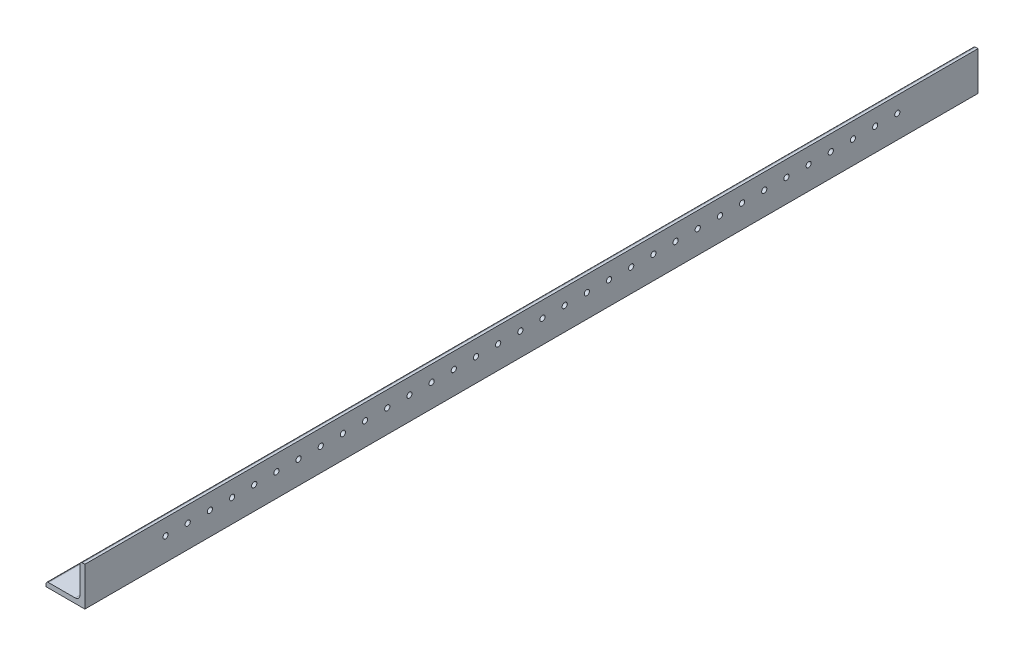
from build123d import *

# Parameters (mm, degrees)
BOSS_EXTRUDE1_DEPTH = 609.6
SKETCH3_W           = 635.2
SKETCH3_H           = 25.4
CUT_EXTRUDE2_DEPTH  = 30.48
SKETCH5_R           = 1.7
CUT_EXTRUDE3_DEPTH  = 611.137198198
SKETCH7_R           = 1.7
CUT_EXTRUDE4_DEPTH  = 611.137198198


with BuildPart() as part:
    # Sketch2 → Boss-Extrude1 (new, symmetric)
    with BuildSketch(Plane.XY):
        with BuildLine():
            Line((-12.7, -12.7), (12.7, -12.7))
            Line((12.7, -12.7), (12.7, 12.7))
            Line((12.7, 12.7), (11.1125, 12.7))
            ThreePointArc((11.1125, 12.7), (9.989967985, 12.235032015), (9.525, 11.1125))
            Line((9.525, 11.1125), (9.525, -6.35))
            ThreePointArc((9.525, -6.35), (8.59506403, -8.59506403), (6.35, -9.525))
            Line((6.35, -9.525), (-11.1125, -9.525))
            ThreePointArc((-11.1125, -9.525), (-12.235032015, -9.989967985), (-12.7, -11.1125))
            Line((-12.7, -11.1125), (-12.7, -12.7))
        make_face()
    extrude(amount=BOSS_EXTRUDE1_DEPTH, both=True)

    # Sketch3 → Cut-Extrude2 (cut)
    with BuildSketch(Plane(origin=(12.7, 0, 0), x_dir=(0, 0, -1), z_dir=(1, 0, 0))):
        with Locations((292, 0)):
            Rectangle(SKETCH3_W, SKETCH3_H)
    extrude(amount=-CUT_EXTRUDE2_DEPTH, mode=Mode.SUBTRACT)

    # Sketch5 → Cut-Extrude3 (cut, through all)
    with BuildSketch(Plane.ZY.offset(-9.525)):
        with Locations((78.35, 2.38125)):
            Circle(SKETCH5_R)
        with Locations((92.85, 2.38125)):
            Circle(SKETCH5_R)
        with Locations((107.35, 2.38125)):
            Circle(SKETCH5_R)
        with Locations((121.85, 2.38125)):
            Circle(SKETCH5_R)
        with Locations((136.35, 2.38125)):
            Circle(SKETCH5_R)
        with Locations((150.85, 2.38125)):
            Circle(SKETCH5_R)
        with Locations((165.35, 2.38125)):
            Circle(SKETCH5_R)
        with Locations((179.85, 2.38125)):
            Circle(SKETCH5_R)
        with Locations((194.35, 2.38125)):
            Circle(SKETCH5_R)
        with Locations((208.85, 2.38125)):
            Circle(SKETCH5_R)
        with Locations((223.35, 2.38125)):
            Circle(SKETCH5_R)
        with Locations((237.85, 2.38125)):
            Circle(SKETCH5_R)
        with Locations((252.35, 2.38125)):
            Circle(SKETCH5_R)
        with Locations((266.85, 2.38125)):
            Circle(SKETCH5_R)
        with Locations((281.35, 2.38125)):
            Circle(SKETCH5_R)
        with Locations((295.85, 2.38125)):
            Circle(SKETCH5_R)
        with Locations((310.35, 2.38125)):
            Circle(SKETCH5_R)
        with Locations((324.85, 2.38125)):
            Circle(SKETCH5_R)
        with Locations((339.35, 2.38125)):
            Circle(SKETCH5_R)
        with Locations((353.85, 2.38125)):
            Circle(SKETCH5_R)
        with Locations((368.35, 2.38125)):
            Circle(SKETCH5_R)
        with Locations((382.85, 2.38125)):
            Circle(SKETCH5_R)
        with Locations((397.35, 2.38125)):
            Circle(SKETCH5_R)
        with Locations((411.85, 2.38125)):
            Circle(SKETCH5_R)
        with Locations((426.35, 2.38125)):
            Circle(SKETCH5_R)
        with Locations((440.85, 2.38125)):
            Circle(SKETCH5_R)
        with Locations((455.35, 2.38125)):
            Circle(SKETCH5_R)
        with Locations((469.85, 2.38125)):
            Circle(SKETCH5_R)
        with Locations((484.35, 2.38125)):
            Circle(SKETCH5_R)
        with Locations((498.85, 2.38125)):
            Circle(SKETCH5_R)
        with Locations((513.35, 2.38125)):
            Circle(SKETCH5_R)
        with Locations((527.85, 2.38125)):
            Circle(SKETCH5_R)
        with Locations((542.35, 2.38125)):
            Circle(SKETCH5_R)
        with Locations((556.85, 2.38125)):
            Circle(SKETCH5_R)
    extrude(amount=-CUT_EXTRUDE3_DEPTH, mode=Mode.SUBTRACT)

    # Sketch7 → Cut-Extrude4 (cut, through all)
    with BuildSketch(Plane(origin=(0, -9.525, 0), x_dir=(1, 0, 0), z_dir=(0, 1, 0))):
        with Locations((-2.38125, -78.35)):
            Circle(SKETCH7_R)
        with Locations((-2.38125, -92.85)):
            Circle(SKETCH7_R)
        with Locations((-2.38125, -107.35)):
            Circle(SKETCH7_R)
        with Locations((-2.38125, -121.85)):
            Circle(SKETCH7_R)
        with Locations((-2.38125, -136.35)):
            Circle(SKETCH7_R)
        with Locations((-2.38125, -150.85)):
            Circle(SKETCH7_R)
        with Locations((-2.38125, -165.35)):
            Circle(SKETCH7_R)
        with Locations((-2.38125, -179.85)):
            Circle(SKETCH7_R)
        with Locations((-2.38125, -194.35)):
            Circle(SKETCH7_R)
        with Locations((-2.38125, -208.85)):
            Circle(SKETCH7_R)
        with Locations((-2.38125, -223.35)):
            Circle(SKETCH7_R)
        with Locations((-2.38125, -237.85)):
            Circle(SKETCH7_R)
        with Locations((-2.38125, -252.35)):
            Circle(SKETCH7_R)
        with Locations((-2.38125, -266.85)):
            Circle(SKETCH7_R)
        with Locations((-2.38125, -281.35)):
            Circle(SKETCH7_R)
        with Locations((-2.38125, -295.85)):
            Circle(SKETCH7_R)
        with Locations((-2.38125, -310.35)):
            Circle(SKETCH7_R)
        with Locations((-2.38125, -324.85)):
            Circle(SKETCH7_R)
        with Locations((-2.38125, -339.35)):
            Circle(SKETCH7_R)
        with Locations((-2.38125, -353.85)):
            Circle(SKETCH7_R)
        with Locations((-2.38125, -368.35)):
            Circle(SKETCH7_R)
        with Locations((-2.38125, -382.85)):
            Circle(SKETCH7_R)
        with Locations((-2.38125, -397.35)):
            Circle(SKETCH7_R)
        with Locations((-2.38125, -411.85)):
            Circle(SKETCH7_R)
        with Locations((-2.38125, -426.35)):
            Circle(SKETCH7_R)
        with Locations((-2.38125, -440.85)):
            Circle(SKETCH7_R)
        with Locations((-2.38125, -455.35)):
            Circle(SKETCH7_R)
        with Locations((-2.38125, -469.85)):
            Circle(SKETCH7_R)
        with Locations((-2.38125, -484.35)):
            Circle(SKETCH7_R)
        with Locations((-2.38125, -498.85)):
            Circle(SKETCH7_R)
        with Locations((-2.38125, -513.35)):
            Circle(SKETCH7_R)
        with Locations((-2.38125, -527.85)):
            Circle(SKETCH7_R)
        with Locations((-2.38125, -542.35)):
            Circle(SKETCH7_R)
        with Locations((-2.38125, -556.85)):
            Circle(SKETCH7_R)
    extrude(amount=-CUT_EXTRUDE4_DEPTH, mode=Mode.SUBTRACT)


solid = part.part
